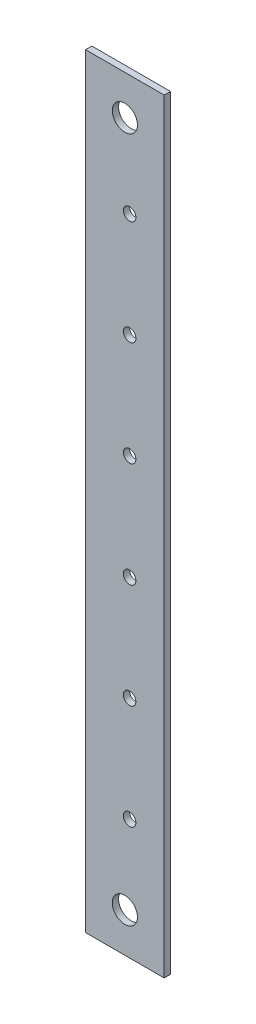
from build123d import *

# Parameters (mm, degrees)
SKETCH1_R           = 4
BOSS_EXTRUDE1_DEPTH = 2
SKETCH2_R           = 2
CUT_EXTRUDE1_DEPTH  = 2


with BuildPart() as part:
    # Sketch1 → Boss-Extrude1 (new body)
    with BuildSketch(Plane.XY):
        Polygon((3.5, 121.5), (12.5, 121.5), (12.5, -121.5), (3.5, -121.5), (0, -121.5), (-12.5, -121.5), (-12.5, -115.487492178), (-12.5, -105.5), (-12.5, 112.5), (-12.5, 121.5), align=None)
        with Locations((0, 109)):
            Circle(SKETCH1_R, mode=Mode.SUBTRACT)
        with Locations((0, -109)):
            Circle(SKETCH1_R, mode=Mode.SUBTRACT)
    extrude(amount=BOSS_EXTRUDE1_DEPTH)

    # Sketch2 → Cut-Extrude1 (cut)
    with BuildSketch(Plane.XY.offset(2)):
        with Locations((1.5, 83.3)):
            Circle(SKETCH2_R)
        with Locations((1.5, 50)):
            Circle(SKETCH2_R)
        with Locations((1.5, 16.7)):
            Circle(SKETCH2_R)
        with Locations((1.5, -16.7)):
            Circle(SKETCH2_R)
        with Locations((1.5, -50)):
            Circle(SKETCH2_R)
        with Locations((1.5, -83.3)):
            Circle(SKETCH2_R)
    extrude(amount=-CUT_EXTRUDE1_DEPTH, mode=Mode.SUBTRACT)


solid = part.part
